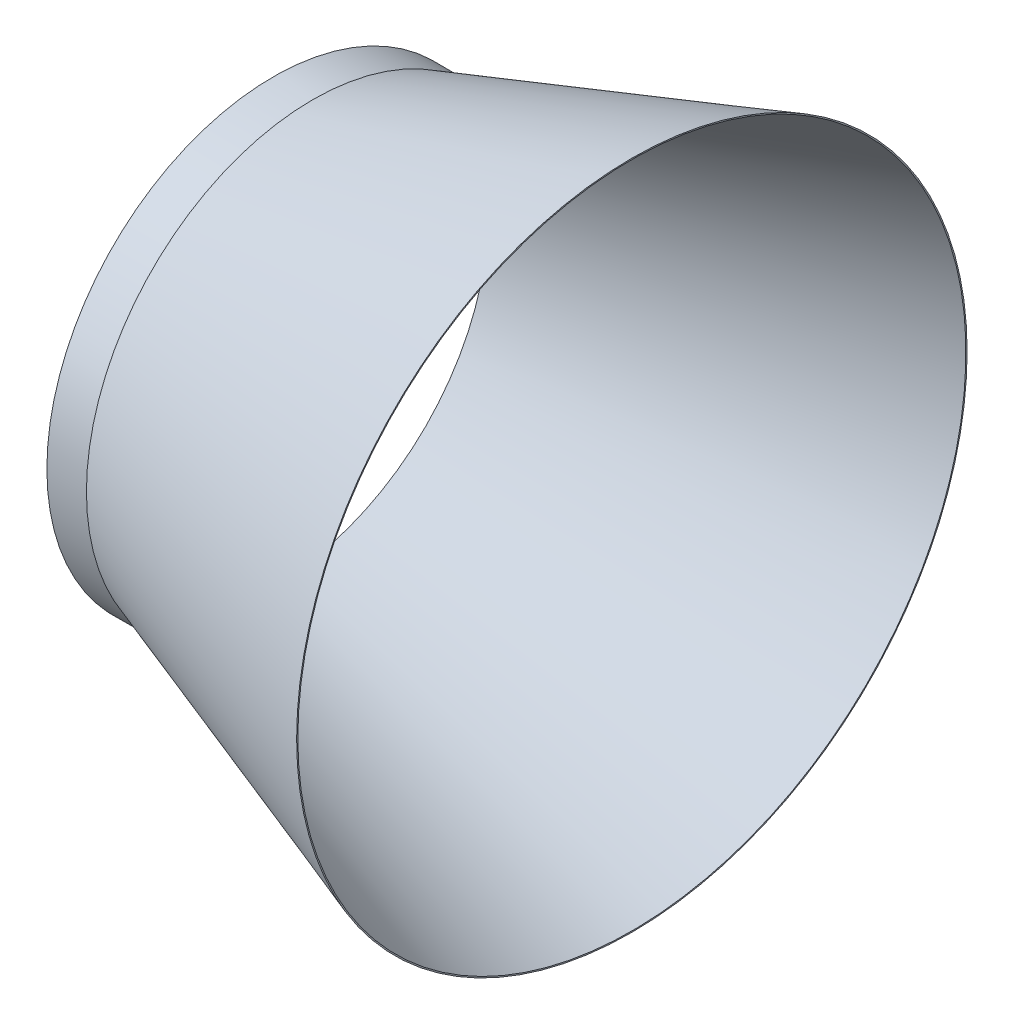
from build123d import *


with BuildPart() as part:
    # Sketch1 → Revolve1 (revolve)
    with BuildSketch(Plane.XY):
        Polygon((0, 47.6758), (79.9592, 74.9554), (79.9592, 75.223775525), (0, 47.944175525), align=None)
    revolve(axis=Axis((0, 0, 0), (1, 0, 0)))

    # Sketch3 → Revolve2 (revolve)
    with BuildSketch(Plane.XY):
        Polygon((0, 47.944175525), (8.370703395, 50.8), (-0.503558907, 50.8), align=None)
    revolve(axis=Axis((0, 0, 0), (1, 0, 0)))


solid = part.part
